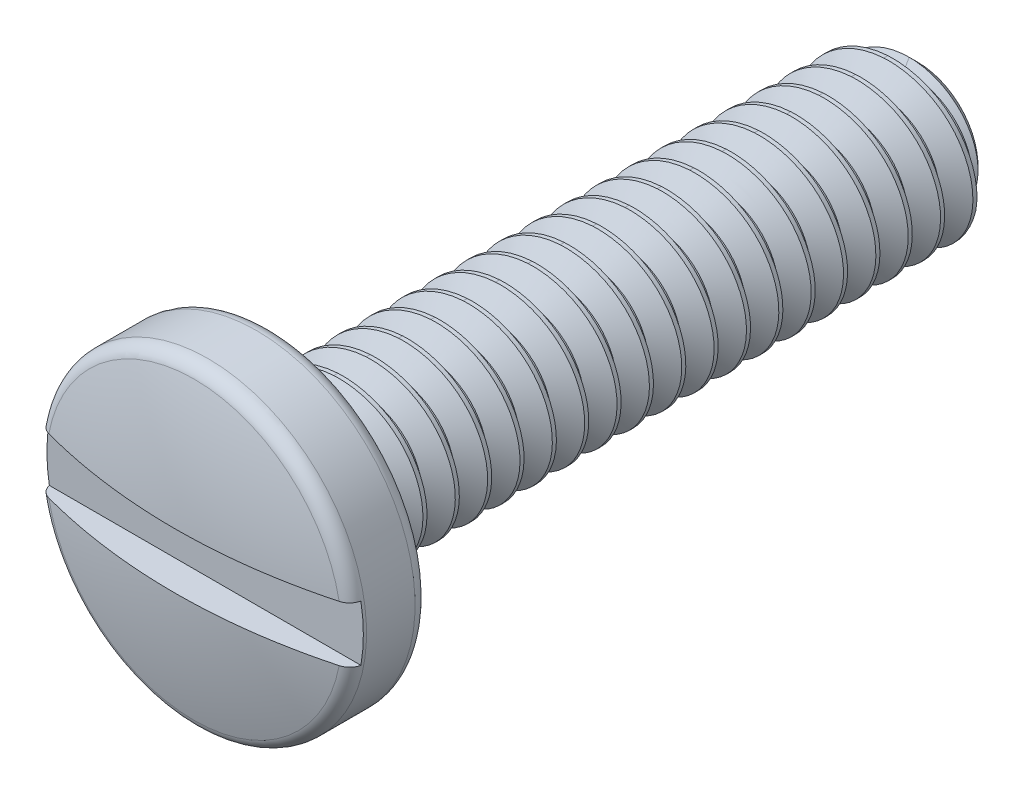
from build123d import *

# Parameters (mm, degrees)
SKETCH3_W               = 12.7
SKETCH3_H               = 1.175055401
SWEEP1_PITCH            = 0.635
SWEEP2_PITCH            = 0.635
SKETCH10_W              = 254
SKETCH10_H              = 12.7
SKETCH8_W               = 1.905
SKETCH8_H               = 3.1115
SKETCH12_W              = 6.223
SKETCH12_H              = 1.0922
CUT_EXTRUDE_THIN2_DEPTH = 0.6096


with BuildPart() as part:
    # Sketch3 → Revolve1 (revolve)
    with BuildSketch(Plane(origin=(0, 0, 0), x_dir=(0, 0, -1), z_dir=(1, 0, 0)), mode=Mode.PRIVATE) as revolve1_sk:
        with Locations((-6.35, 0.587527701)):
            Rectangle(SKETCH3_W, SKETCH3_H)
    revolve(revolve1_sk.sketch.rotate(Axis((0, 0, 0), (0, 0, -1)), 90), axis=Axis((0, 0, 0), (0, 0, -1)))

    # Sweep1: the profile of Sketch2 profile screwed along a right-hand helix of 21 turns, 6 arcs to a turn; built about Z, then put on its axis
    sweep1_z = Axis((0, 0, 0), (0, 0, 1))
    sweep1_corners = [(1.5875, 0, 0.0396875), (1.5875, 0, -0.0396875), (1.174755401, 0, -0.277985705), (1.174755401, 0, 0.277985705)]
    with BuildLine(mode=Mode.PRIVATE) as sweep1_profile:
        Line(sweep1_corners[0], sweep1_corners[1])
        Line(sweep1_corners[1], sweep1_corners[2])
        Line(sweep1_corners[2], sweep1_corners[3])
        Line(sweep1_corners[3], sweep1_corners[0])
    sweep1_cap = Face(sweep1_profile.wire())
    sweep1_turn_angles = [0, 30, 60, 90, 120, 150, 180, 210, 240, 270, 300, 330, 360]
    sweep1_turn_weights = [1, 0.8660254037844387, 1, 0.8660254037844387, 1, 0.8660254037844387, 1, 0.8660254037844387, 1, 0.8660254037844387, 1, 0.8660254037844387, 1]
    sweep1_turn_rails = [Edge.make_bspline([Vector(p[0], p[1], 0).rotate(sweep1_z, sweep1_turn_angles[k]) / sweep1_turn_weights[k] + Vector(0, 0, p[2] + SWEEP1_PITCH * sweep1_turn_angles[k] / 360) for k in range(13)], [0, 0, 0, 1, 1, 2, 2, 3, 3, 4, 4, 5, 5, 6, 6, 6], 2, sweep1_turn_weights) for p in sweep1_corners]
    sweep1_turn_sides = [Face.make_surface_from_curves(sweep1_turn_rails[p[0]], sweep1_turn_rails[p[1]]) for p in [(0, 1), (1, 2), (2, 3), (3, 0)]]
    sweep1 = Plane(origin=(0, 0, 0), x_dir=(0, 1, 0), z_dir=(0, 0, 1)) * Solid(Shell([*[p.moved(Location((0, 0, SWEEP1_PITCH * i))) for i in range(21) for p in sweep1_turn_sides], sweep1_cap, sweep1_cap.rotate(sweep1_z, 7560).moved(Location((0, 0, SWEEP1_PITCH * 7560 / 360)))]))
    add(sweep1)

    # Sweep2: the profile of Sketch6 screwed along a right-hand helix of 1 turns, 6 arcs to a turn; built about Z, then put on its axis
    sweep2_z = Axis((0, 0, 0), (0, 0, 1))
    sweep2_corners = [(1.5875, 0, -0.0396875), (1.175055401, 0, -0.2778125), (1.175055401, 0, 0), (1.175055401, 0, 0.2778125), (1.5875, 0, 0.0396875)]
    with BuildLine(mode=Mode.PRIVATE) as sweep2_profile:
        Line(sweep2_corners[0], sweep2_corners[1])
        Line(sweep2_corners[1], sweep2_corners[2])
        Line(sweep2_corners[2], sweep2_corners[3])
        Line(sweep2_corners[3], sweep2_corners[4])
        Line(sweep2_corners[4], sweep2_corners[0])
    sweep2_cap = Face(sweep2_profile.wire())
    sweep2_turn_angles = [0, 30, 60, 90, 120, 150, 180, 210, 240, 270, 300, 330, 360]
    sweep2_turn_weights = [1, 0.8660254037844387, 1, 0.8660254037844387, 1, 0.8660254037844387, 1, 0.8660254037844387, 1, 0.8660254037844387, 1, 0.8660254037844387, 1]
    sweep2_turn_rails = [Edge.make_bspline([Vector(p[0], p[1], 0).rotate(sweep2_z, sweep2_turn_angles[k]) / sweep2_turn_weights[k] + Vector(0, 0, p[2] + SWEEP2_PITCH * sweep2_turn_angles[k] / 360) for k in range(13)], [0, 0, 0, 1, 1, 2, 2, 3, 3, 4, 4, 5, 5, 6, 6, 6], 2, sweep2_turn_weights) for p in sweep2_corners]
    sweep2_turn_sides = [Face.make_surface_from_curves(sweep2_turn_rails[p[0]], sweep2_turn_rails[p[1]]) for p in [(0, 1), (1, 2), (2, 3), (3, 4), (4, 0)]]
    sweep2 = Plane(origin=(0, 0, 0), x_dir=(0, 1, 0), z_dir=(0, 0, -1)) * Solid(Shell([*sweep2_turn_sides, sweep2_cap, sweep2_cap.rotate(sweep2_z, 360).moved(Location((0, 0, SWEEP2_PITCH * 360 / 360)))]))
    add(sweep2)

    # Sketch4 → Cut-Revolve1 (revolve, cut)
    with BuildSketch(Plane(origin=(0, 0, 0), x_dir=(0, 0, -1), z_dir=(1, 0, 0))):
        Polygon((0, 1.175055401), (-3.175, 4.350055401), (2.54, 4.350055401), (2.54, 0), (0, 0), align=None)
    revolve(axis=Axis((0, 0, -2.54), (0, 0, -1)), mode=Mode.SUBTRACT)

    # Sketch10 → Cut-Revolve2 (revolve, cut)
    with BuildSketch(Plane(origin=(0, 0, 0), x_dir=(0, 0, -1), z_dir=(1, 0, 0))):
        with Locations((-139.7, 6.35)):
            Rectangle(SKETCH10_W, SKETCH10_H)
    revolve(axis=Axis((0, 0, 0), (0, 0, -1)), mode=Mode.SUBTRACT)

    # Sketch8 → Revolve2 (revolve)
    with BuildSketch(Plane(origin=(0, 0, 0), x_dir=(0, 0, -1), z_dir=(1, 0, 0)), mode=Mode.PRIVATE) as revolve2_sk:
        with Locations((-13.6525, 1.55575)):
            Rectangle(SKETCH8_W, SKETCH8_H)
    revolve(revolve2_sk.sketch.rotate(Axis((0, 0, 0), (0, 0, 1)), 90), axis=Axis((0, 0, 0), (0, 0, 1)))

    # Sketch11 → Cut-Revolve3 (revolve, cut)
    with BuildSketch(Plane(origin=(0, 0, 0), x_dir=(0, 0, -1), z_dir=(1, 0, 0)), mode=Mode.PRIVATE) as cut_revolve3_sk:
        with BuildLine():
            Line((-13.93825, 3.1115), (-12.98575, 3.1115))
            ThreePointArc((-12.98575, 3.1115), (-12.783694237, 3.027805763), (-12.7, 2.82575))
            Line((-12.7, 2.82575), (-12.065, 2.82575))
            Line((-12.065, 2.82575), (-12.065, 3.7465))
            Line((-12.065, 3.7465), (-15.24, 3.7465))
            Line((-15.24, 3.7465), (-15.24, 0))
            Line((-15.24, 0), (-14.605, 0))
            ThreePointArc((-14.605, 0), (-14.506758478, 1.463842435), (-14.213795908, 2.901430347))
            ThreePointArc((-14.213795908, 2.901430347), (-14.111494629, 3.052992956), (-13.93825, 3.1115))
        make_face()
    revolve(cut_revolve3_sk.sketch.rotate(Axis((0, 0, 14.605), (0, 0, -1)), 180), axis=Axis((0, 0, 14.605), (0, 0, -1)), mode=Mode.SUBTRACT)

    # Sketch12 → Cut-Extrude-Thin2 (cut)
    with BuildSketch(Plane.XY.offset(14.605)):
        Rectangle(SKETCH12_W, SKETCH12_H)
    extrude(amount=-CUT_EXTRUDE_THIN2_DEPTH, mode=Mode.SUBTRACT)


solid = part.part
